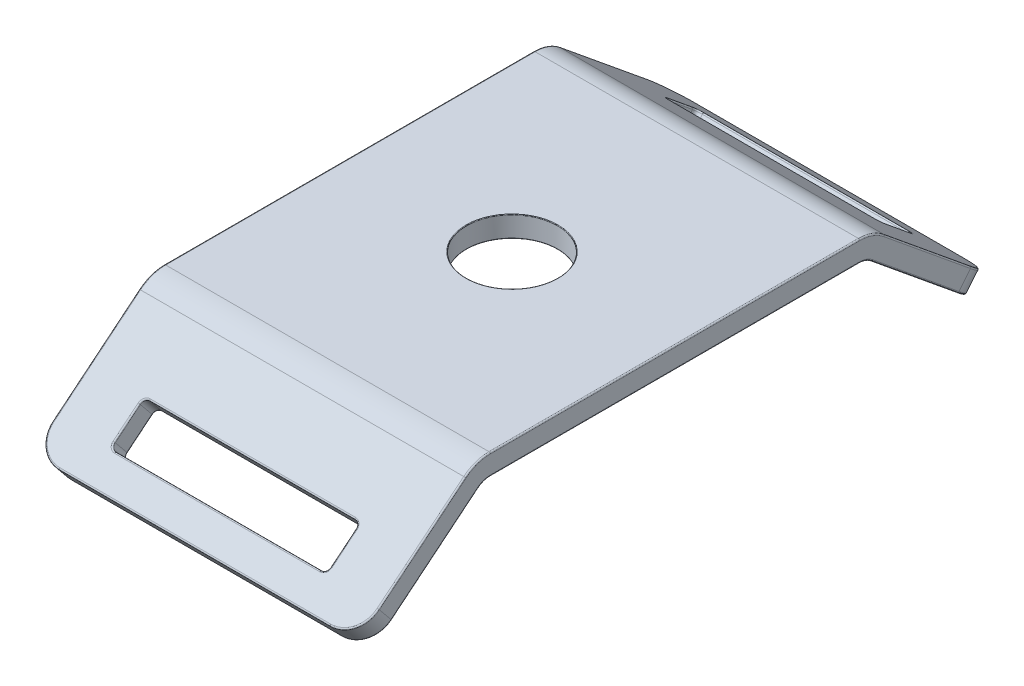
from build123d import *

# Parameters (mm, degrees)
BOSS_EXTRUDE1_DEPTH      = 7.5
BOSS_EXTRUDE1_DEPTH_BACK = 7.5
FILLET4_R                = 1.27
FILLET2_R                = 0.0635
CUT_EXTRUDE1_DEPTH       = 18.217723585
CUT_EXTRUDE1_DEPTH_BACK  = 18.217723585
SKETCH4_R                = 2.1
FILLET1_R                = 0.0254
CUT_EXTRUDE2_DEPTH       = 25.435726055
FILLET3_R                = 0.0635


with BuildPart() as part:
    # Sketch3 → Boss-Extrude1 (new, two sides: drawn at the far end of the back side and taken through both)
    with BuildSketch(Plane(origin=(0, 0, 0), x_dir=(0, 0, -1), z_dir=(1, 0, 0)).offset(-BOSS_EXTRUDE1_DEPTH_BACK)):
        with BuildLine():
            Line((-14.576716292, -1.838688841), (-9.658229197, 2.186478971))
            ThreePointArc((-9.658229197, 2.186478971), (-9.114917579, 2.493519892), (-8.5, 2.6))
            Line((-8.5, 2.6), (8.5, 2.6))
            ThreePointArc((8.5, 2.6), (9.114917579, 2.493519892), (9.658229197, 2.186478971))
            Line((9.658229197, 2.186478971), (14.576716292, -1.838688841))
            ThreePointArc((14.576716292, -1.838688841), (14.599685593, -1.881519304), (14.585641631, -1.928046763))
            Line((14.585641631, -1.928046763), (14.054786582, -2.576716292))
            ThreePointArc((14.054786582, -2.576716292), (14.011956119, -2.599685593), (13.96542866, -2.585641631))
            Line((13.96542866, -2.585641631), (9.060977542, 1.428039486))
            ThreePointArc((9.060977542, 1.428039486), (8.789321733, 1.581559946), (8.481862944, 1.6348))
            Line((8.481862944, 1.6348), (-8.481862944, 1.6348))
            ThreePointArc((-8.481862944, 1.6348), (-8.789321733, 1.581559946), (-9.060977542, 1.428039486))
            Line((-9.060977542, 1.428039486), (-13.96542866, -2.585641631))
            ThreePointArc((-13.96542866, -2.585641631), (-14.011956119, -2.599685593), (-14.054786582, -2.576716292))
            Line((-14.054786582, -2.576716292), (-14.585641631, -1.928046763))
            ThreePointArc((-14.585641631, -1.928046763), (-14.599685593, -1.881519304), (-14.576716292, -1.838688841))
        make_face()
    extrude(amount=BOSS_EXTRUDE1_DEPTH + BOSS_EXTRUDE1_DEPTH_BACK)

    # Fillet4
    # the kernel refuses this fillet: 1.27 mm, written as the material it takes off along each edge
    with BuildSketch(Plane(origin=(-7.5, -5.033797839, 12.043972003), x_dir=(1, 0, 0), z_dir=(0, 0.7738839518742416, 0.6333274264008363)), Plane(origin=(-7.5, 0.529034784, -16.59645621), x_dir=(1, 0, 0), z_dir=(0, -0.7738839518742416, 0.6333274264008363))) as fillet4_piece_1:
        with BuildLine():
            CenterArc((FILLET4_R, FILLET4_R), FILLET4_R, 180, 90)
            Line((0, FILLET4_R), (0, 0))
            Line((0, 0), (FILLET4_R, 0))
        make_face()
    extrude(amount=7.1882, mode=Mode.SUBTRACT)
    with BuildSketch(Plane(origin=(7.5, -5.033797839, 12.043972003), x_dir=(-1, 0, 0), z_dir=(0, 0.7738839518742416, 0.6333274264008363)), Plane(origin=(7.5, 0.529034784, -16.59645621), x_dir=(-1, 0, 0), z_dir=(0, -0.7738839518742416, 0.6333274264008363))) as fillet4_piece_2:
        with BuildLine():
            CenterArc((FILLET4_R, -FILLET4_R), FILLET4_R, 90, 90)
            Line((0, -FILLET4_R), (0, 0))
            Line((0, 0), (FILLET4_R, 0))
        make_face()
    extrude(amount=7.1882, mode=Mode.SUBTRACT)

    # Fillet2
    # the kernel refuses this fillet: 0.0635 mm, written as the material it takes off along each edge
    with BuildSketch(Plane(origin=(-7.5, 1.428039486, 9.060977542), x_dir=(1, 0, 0), z_dir=(0, -0.6333274264008348, 0.7738839518742426)), Plane(origin=(7.5, -1.821532091, -13.031737672), x_dir=(0, 0.7738839518742426, -0.6333274264008346), z_dir=(0, 0.6333274264008347, 0.7738839518742427))) as fillet2_piece_1:
        with BuildLine():
            CenterArc((FILLET2_R, FILLET2_R), FILLET2_R, 180, 90)
            Line((0, FILLET2_R), (-FILLET2_R * 0.02, FILLET2_R))
            Line((-FILLET2_R * 0.02, FILLET2_R), (-FILLET2_R * 0.02, -FILLET2_R * 0.02))
            Line((-FILLET2_R * 0.02, -FILLET2_R * 0.02), (FILLET2_R, -FILLET2_R * 0.02))
            Line((FILLET2_R, -FILLET2_R * 0.02), (FILLET2_R, 0))
        make_face()
    extrude(amount=5.130950344, mode=Mode.SUBTRACT)
    with BuildSketch(Plane(origin=(-7.5, 0.7204, 8.481862944), x_dir=(0, 1, 0), z_dir=(0, 0, -1))) as fillet2_piece_2:
        with BuildLine():
            CenterArc((0.9144 + FILLET2_R, FILLET2_R), FILLET2_R, 180, 90)
            Line((0.9144, FILLET2_R), (0.9144 - FILLET2_R * 0.02, FILLET2_R))
            Line((0.9144 - FILLET2_R * 0.02, FILLET2_R), (0.9144 - FILLET2_R * 0.02, -FILLET2_R * 0.02))
            Line((0.9144 - FILLET2_R * 0.02, -FILLET2_R * 0.02), (0.9144 + FILLET2_R, -FILLET2_R * 0.02))
            Line((0.9144 + FILLET2_R, -FILLET2_R * 0.02), (0.9144 + FILLET2_R, 0))
        make_face()
    revolve(axis=Axis((-7.5, 0.7204, 8.481862944), (1, 0, 0)), revolution_arc=39.296042908, mode=Mode.SUBTRACT)
    with BuildSketch(Plane(origin=(-7.5, 1.6348, -8.481862944), x_dir=(0, 1, 0), z_dir=(0, 0, 1))) as fillet2_piece_3:
        with BuildLine():
            CenterArc((FILLET2_R, -FILLET2_R), FILLET2_R, 90, 90)
            Line((0, -FILLET2_R), (-FILLET2_R * 0.02, -FILLET2_R))
            Line((-FILLET2_R * 0.02, -FILLET2_R), (-FILLET2_R * 0.02, FILLET2_R * 0.02))
            Line((-FILLET2_R * 0.02, FILLET2_R * 0.02), (FILLET2_R, FILLET2_R * 0.02))
            Line((FILLET2_R, FILLET2_R * 0.02), (FILLET2_R, 0))
        make_face()
    extrude(amount=16.963725887, mode=Mode.SUBTRACT)
    with BuildSketch(Plane(origin=(-7.5, 0.7204, -8.481862944), x_dir=(0, 0.7738839518742434, -0.6333274264008341), z_dir=(0, -0.6333274264008341, -0.7738839518742434))) as fillet2_piece_4:
        with BuildLine():
            CenterArc((0.9144 + FILLET2_R, FILLET2_R), FILLET2_R, 180, 90)
            Line((0.9144, FILLET2_R), (0.9144 - FILLET2_R * 0.02, FILLET2_R))
            Line((0.9144 - FILLET2_R * 0.02, FILLET2_R), (0.9144 - FILLET2_R * 0.02, -FILLET2_R * 0.02))
            Line((0.9144 - FILLET2_R * 0.02, -FILLET2_R * 0.02), (0.9144 + FILLET2_R, -FILLET2_R * 0.02))
            Line((0.9144 + FILLET2_R, -FILLET2_R * 0.02), (0.9144 + FILLET2_R, 0))
        make_face()
    revolve(axis=Axis((-7.5, 0.7204, -8.481862944), (1, 0, 0)), revolution_arc=39.296042908, mode=Mode.SUBTRACT)
    with BuildSketch(Plane(origin=(-7.5, -1.821532091, -13.031737672), x_dir=(0, 0.7738839518742426, -0.6333274264008346), z_dir=(0, 0.6333274264008347, 0.7738839518742427)), Plane(origin=(7.5, 1.428039486, 9.060977542), x_dir=(-1, 0, 0), z_dir=(0, -0.6333274264008348, 0.7738839518742426))) as fillet2_piece_5:
        with BuildLine():
            CenterArc((FILLET2_R, -FILLET2_R), FILLET2_R, 90, 90)
            Line((0, -FILLET2_R), (-FILLET2_R * 0.02, -FILLET2_R))
            Line((-FILLET2_R * 0.02, -FILLET2_R), (-FILLET2_R * 0.02, FILLET2_R * 0.02))
            Line((-FILLET2_R * 0.02, FILLET2_R * 0.02), (FILLET2_R, FILLET2_R * 0.02))
            Line((FILLET2_R, FILLET2_R * 0.02), (FILLET2_R, 0))
        make_face()
    extrude(amount=5.130950344, mode=Mode.SUBTRACT)
    with BuildSketch(Plane(origin=(-7.5, 2.186478971, -9.658229197), x_dir=(0, -0.7738839518742431, 0.6333274264008345), z_dir=(0, -0.6333274264008345, -0.7738839518742431)), Plane(origin=(7.5, -1.074579301, 13.643025304), x_dir=(-1, 0, 0), z_dir=(0, 0.6333274264008345, -0.773883951874243))) as fillet2_piece_6:
        with BuildLine():
            CenterArc((FILLET2_R, -FILLET2_R), FILLET2_R, 90, 90)
            Line((0, -FILLET2_R), (-FILLET2_R * 0.02, -FILLET2_R))
            Line((-FILLET2_R * 0.02, -FILLET2_R), (-FILLET2_R * 0.02, FILLET2_R * 0.02))
            Line((-FILLET2_R * 0.02, FILLET2_R * 0.02), (FILLET2_R, FILLET2_R * 0.02))
            Line((FILLET2_R, FILLET2_R * 0.02), (FILLET2_R, 0))
        make_face()
    extrude(amount=5.149087401, mode=Mode.SUBTRACT)
    with BuildSketch(Plane(origin=(-7.5, 0.7712, -8.5), x_dir=(0, 1, 0), z_dir=(0, 0, 1))) as fillet2_piece_7:
        with BuildLine():
            CenterArc((1.8288 - FILLET2_R, -FILLET2_R), FILLET2_R, 0, 90)
            Line((1.8288, -FILLET2_R), (1.8288 + FILLET2_R * 0.02, -FILLET2_R))
            Line((1.8288 + FILLET2_R * 0.02, -FILLET2_R), (1.8288 + FILLET2_R * 0.02, FILLET2_R * 0.02))
            Line((1.8288 + FILLET2_R * 0.02, FILLET2_R * 0.02), (1.8288 - FILLET2_R, FILLET2_R * 0.02))
            Line((1.8288 - FILLET2_R, FILLET2_R * 0.02), (1.8288 - FILLET2_R, 0))
        make_face()
    revolve(axis=Axis((-7.5, 0.7712, -8.5), (-1, 0, 0)), revolution_arc=39.296042908, mode=Mode.SUBTRACT)
    with BuildSketch(Plane(origin=(-7.5, 2.6, 8.5), x_dir=(0, -1, 0), z_dir=(0, 0, -1))) as fillet2_piece_8:
        with BuildLine():
            CenterArc((FILLET2_R, -FILLET2_R), FILLET2_R, 90, 90)
            Line((0, -FILLET2_R), (-FILLET2_R * 0.02, -FILLET2_R))
            Line((-FILLET2_R * 0.02, -FILLET2_R), (-FILLET2_R * 0.02, FILLET2_R * 0.02))
            Line((-FILLET2_R * 0.02, FILLET2_R * 0.02), (FILLET2_R, FILLET2_R * 0.02))
            Line((FILLET2_R, FILLET2_R * 0.02), (FILLET2_R, 0))
        make_face()
    extrude(amount=17, mode=Mode.SUBTRACT)
    with BuildSketch(Plane(origin=(-7.5, 0.7712, 8.5), x_dir=(0, 0.7738839518742435, 0.6333274264008336), z_dir=(0, -0.6333274264008336, 0.7738839518742435))) as fillet2_piece_9:
        with BuildLine():
            CenterArc((1.8288 - FILLET2_R, -FILLET2_R), FILLET2_R, 0, 90)
            Line((1.8288, -FILLET2_R), (1.8288 + FILLET2_R * 0.02, -FILLET2_R))
            Line((1.8288 + FILLET2_R * 0.02, -FILLET2_R), (1.8288 + FILLET2_R * 0.02, FILLET2_R * 0.02))
            Line((1.8288 + FILLET2_R * 0.02, FILLET2_R * 0.02), (1.8288 - FILLET2_R, FILLET2_R * 0.02))
            Line((1.8288 - FILLET2_R, FILLET2_R * 0.02), (1.8288 - FILLET2_R, 0))
        make_face()
    revolve(axis=Axis((-7.5, 0.7712, 8.5), (-1, 0, 0)), revolution_arc=39.296042908, mode=Mode.SUBTRACT)
    with BuildSketch(Plane(origin=(-7.5, -1.074579301, 13.643025304), x_dir=(1, 0, 0), z_dir=(0, 0.6333274264008345, -0.773883951874243)), Plane(origin=(7.5, 2.186478971, -9.658229197), x_dir=(0, -0.7738839518742431, 0.6333274264008345), z_dir=(0, -0.6333274264008345, -0.7738839518742431))) as fillet2_piece_10:
        with BuildLine():
            CenterArc((FILLET2_R, FILLET2_R), FILLET2_R, 180, 90)
            Line((0, FILLET2_R), (-FILLET2_R * 0.02, FILLET2_R))
            Line((-FILLET2_R * 0.02, FILLET2_R), (-FILLET2_R * 0.02, -FILLET2_R * 0.02))
            Line((-FILLET2_R * 0.02, -FILLET2_R * 0.02), (FILLET2_R, -FILLET2_R * 0.02))
            Line((FILLET2_R, -FILLET2_R * 0.02), (FILLET2_R, 0))
        make_face()
    extrude(amount=5.149087401, mode=Mode.SUBTRACT)
    with BuildSketch(Plane(origin=(7.5, 0.7712, 8.5), x_dir=(0, 0.7738839518742435, 0.6333274264008336), z_dir=(0, -0.6333274264008336, 0.7738839518742435))) as fillet2_piece_11:
        with BuildLine():
            CenterArc((1.8288 - FILLET2_R, FILLET2_R), FILLET2_R, 270, 90)
            Line((1.8288, FILLET2_R), (1.8288 + FILLET2_R * 0.02, FILLET2_R))
            Line((1.8288 + FILLET2_R * 0.02, FILLET2_R), (1.8288 + FILLET2_R * 0.02, -FILLET2_R * 0.02))
            Line((1.8288 + FILLET2_R * 0.02, -FILLET2_R * 0.02), (1.8288 - FILLET2_R, -FILLET2_R * 0.02))
            Line((1.8288 - FILLET2_R, -FILLET2_R * 0.02), (1.8288 - FILLET2_R, 0))
        make_face()
    revolve(axis=Axis((7.5, 0.7712, 8.5), (-1, 0, 0)), revolution_arc=39.296042908, mode=Mode.SUBTRACT)
    with BuildSketch(Plane(origin=(7.5, 2.6, 8.5), x_dir=(0, -1, 0), z_dir=(0, 0, -1))) as fillet2_piece_12:
        with BuildLine():
            CenterArc((FILLET2_R, FILLET2_R), FILLET2_R, 180, 90)
            Line((0, FILLET2_R), (-FILLET2_R * 0.02, FILLET2_R))
            Line((-FILLET2_R * 0.02, FILLET2_R), (-FILLET2_R * 0.02, -FILLET2_R * 0.02))
            Line((-FILLET2_R * 0.02, -FILLET2_R * 0.02), (FILLET2_R, -FILLET2_R * 0.02))
            Line((FILLET2_R, -FILLET2_R * 0.02), (FILLET2_R, 0))
        make_face()
    extrude(amount=17, mode=Mode.SUBTRACT)
    with BuildSketch(Plane(origin=(7.5, 0.7712, -8.5), x_dir=(0, 1, 0), z_dir=(0, 0, 1))) as fillet2_piece_13:
        with BuildLine():
            CenterArc((1.8288 - FILLET2_R, FILLET2_R), FILLET2_R, 270, 90)
            Line((1.8288, FILLET2_R), (1.8288 + FILLET2_R * 0.02, FILLET2_R))
            Line((1.8288 + FILLET2_R * 0.02, FILLET2_R), (1.8288 + FILLET2_R * 0.02, -FILLET2_R * 0.02))
            Line((1.8288 + FILLET2_R * 0.02, -FILLET2_R * 0.02), (1.8288 - FILLET2_R, -FILLET2_R * 0.02))
            Line((1.8288 - FILLET2_R, -FILLET2_R * 0.02), (1.8288 - FILLET2_R, 0))
        make_face()
    revolve(axis=Axis((7.5, 0.7712, -8.5), (-1, 0, 0)), revolution_arc=39.296042908, mode=Mode.SUBTRACT)
    with BuildSketch(Plane(origin=(7.5, 0.7204, -8.481862944), x_dir=(0, 0.7738839518742434, -0.6333274264008341), z_dir=(0, -0.6333274264008341, -0.7738839518742434))) as fillet2_piece_14:
        with BuildLine():
            CenterArc((0.9144 + FILLET2_R, -FILLET2_R), FILLET2_R, 90, 90)
            Line((0.9144, -FILLET2_R), (0.9144 - FILLET2_R * 0.02, -FILLET2_R))
            Line((0.9144 - FILLET2_R * 0.02, -FILLET2_R), (0.9144 - FILLET2_R * 0.02, FILLET2_R * 0.02))
            Line((0.9144 - FILLET2_R * 0.02, FILLET2_R * 0.02), (0.9144 + FILLET2_R, FILLET2_R * 0.02))
            Line((0.9144 + FILLET2_R, FILLET2_R * 0.02), (0.9144 + FILLET2_R, 0))
        make_face()
    revolve(axis=Axis((7.5, 0.7204, -8.481862944), (1, 0, 0)), revolution_arc=39.296042908, mode=Mode.SUBTRACT)
    with BuildSketch(Plane(origin=(7.5, 1.6348, -8.481862944), x_dir=(0, 1, 0), z_dir=(0, 0, 1))) as fillet2_piece_15:
        with BuildLine():
            CenterArc((FILLET2_R, FILLET2_R), FILLET2_R, 180, 90)
            Line((0, FILLET2_R), (-FILLET2_R * 0.02, FILLET2_R))
            Line((-FILLET2_R * 0.02, FILLET2_R), (-FILLET2_R * 0.02, -FILLET2_R * 0.02))
            Line((-FILLET2_R * 0.02, -FILLET2_R * 0.02), (FILLET2_R, -FILLET2_R * 0.02))
            Line((FILLET2_R, -FILLET2_R * 0.02), (FILLET2_R, 0))
        make_face()
    extrude(amount=16.963725887, mode=Mode.SUBTRACT)
    with BuildSketch(Plane(origin=(7.5, 0.7204, 8.481862944), x_dir=(0, 1, 0), z_dir=(0, 0, -1))) as fillet2_piece_16:
        with BuildLine():
            CenterArc((0.9144 + FILLET2_R, -FILLET2_R), FILLET2_R, 90, 90)
            Line((0.9144, -FILLET2_R), (0.9144 - FILLET2_R * 0.02, -FILLET2_R))
            Line((0.9144 - FILLET2_R * 0.02, -FILLET2_R), (0.9144 - FILLET2_R * 0.02, FILLET2_R * 0.02))
            Line((0.9144 - FILLET2_R * 0.02, FILLET2_R * 0.02), (0.9144 + FILLET2_R, FILLET2_R * 0.02))
            Line((0.9144 + FILLET2_R, FILLET2_R * 0.02), (0.9144 + FILLET2_R, 0))
        make_face()
    revolve(axis=Axis((7.5, 0.7204, 8.481862944), (1, 0, 0)), revolution_arc=39.296042908, mode=Mode.SUBTRACT)
    with BuildSketch(Plane(origin=(-6.23, -1.074579301, -13.643025304), x_dir=(-0.017482835375582595, -0.6332306308881265, -0.7737656742013408), z_dir=(0.9998471635541255, -0.011072359134611005, -0.013529685730419553))) as fillet2_piece_17:
        with BuildLine():
            CenterArc((1.27 - FILLET2_R, -FILLET2_R), FILLET2_R, 0, 90)
            Line((1.27 - FILLET2_R, 0), (1.27 - FILLET2_R, FILLET2_R * 0.0199999999997))
            Line((1.27 - FILLET2_R, FILLET2_R * 0.0199999999997), (1.27 + FILLET2_R * 0.02, FILLET2_R * 0.02))
            Line((1.27 + FILLET2_R * 0.02, FILLET2_R * 0.02), (1.27 + FILLET2_R * 0.02, -FILLET2_R))
            Line((1.27 + FILLET2_R * 0.02, -FILLET2_R), (1.27, -FILLET2_R))
        make_face()
    revolve(axis=Axis((-6.23, -1.074579301, -13.643025304), (0, 0.7738839518740644, -0.6333274264010527)), revolution_arc=88.998256284, mode=Mode.SUBTRACT)
    with BuildSketch(Plane(origin=(-6.23, -1.074579301, 13.643025304), x_dir=(-0.01748283537898076, -0.633230630888089, 0.7737656742012949), z_dir=(0.9998471635540662, -0.011072359136763157, 0.013529685733049336))) as fillet2_piece_18:
        with BuildLine():
            CenterArc((1.27 - FILLET2_R, FILLET2_R), FILLET2_R, 270, 90)
            Line((1.27 - FILLET2_R, 0), (1.27 - FILLET2_R, -FILLET2_R * 0.0199999999997))
            Line((1.27 - FILLET2_R, -FILLET2_R * 0.0199999999997), (1.27 + FILLET2_R * 0.02, -FILLET2_R * 0.02))
            Line((1.27 + FILLET2_R * 0.02, -FILLET2_R * 0.02), (1.27 + FILLET2_R * 0.02, FILLET2_R))
            Line((1.27 + FILLET2_R * 0.02, FILLET2_R), (1.27, FILLET2_R))
        make_face()
    revolve(axis=Axis((-6.23, -1.074579301, 13.643025304), (0, -0.7738839518740644, -0.6333274264010527)), revolution_arc=88.998256284, mode=Mode.SUBTRACT)
    with BuildSketch(Plane(origin=(-6.23, -1.821532091, 13.031737672), x_dir=(-0.017482835378398207, -0.6332306308880957, 0.7737656742013023), z_dir=(0.9998471635540762, -0.01107235913639421, 0.01352968573259851))) as fillet2_piece_19:
        with BuildLine():
            CenterArc((1.27 - FILLET2_R, -FILLET2_R), FILLET2_R, 0, 90)
            Line((1.27 - FILLET2_R, 0), (1.27 - FILLET2_R, FILLET2_R * 0.0200000000003))
            Line((1.27 - FILLET2_R, FILLET2_R * 0.0200000000003), (1.27 + FILLET2_R * 0.02, FILLET2_R * 0.02))
            Line((1.27 + FILLET2_R * 0.02, FILLET2_R * 0.02), (1.27 + FILLET2_R * 0.02, -FILLET2_R))
            Line((1.27 + FILLET2_R * 0.02, -FILLET2_R), (1.27, -FILLET2_R))
        make_face()
    revolve(axis=Axis((-6.23, -1.821532091, 13.031737672), (0, -0.7738839518740644, -0.6333274264010527)), revolution_arc=88.998256284, mode=Mode.SUBTRACT)
    with BuildSketch(Plane(origin=(-6.23, -1.821532091, -13.031737672), x_dir=(-0.01748283537503431, -0.6332306308881327, -0.7737656742013482), z_dir=(0.9998471635541353, -0.011072359134263762, -0.013529685729995244))) as fillet2_piece_20:
        with BuildLine():
            CenterArc((1.27 - FILLET2_R, FILLET2_R), FILLET2_R, 270, 90)
            Line((1.27, FILLET2_R), (1.27 + FILLET2_R * 0.02, FILLET2_R))
            Line((1.27 + FILLET2_R * 0.02, FILLET2_R), (1.27 + FILLET2_R * 0.02, -FILLET2_R * 0.02))
            Line((1.27 + FILLET2_R * 0.02, -FILLET2_R * 0.02), (1.27 - FILLET2_R, -FILLET2_R * 0.0200000000003))
            Line((1.27 - FILLET2_R, -FILLET2_R * 0.0200000000003), (1.27 - FILLET2_R, 0))
        make_face()
    revolve(axis=Axis((-6.23, -1.821532091, -13.031737672), (0, 0.7738839518740644, -0.6333274264010527)), revolution_arc=88.998256284, mode=Mode.SUBTRACT)
    with BuildSketch(Plane(origin=(6.23, -1.821532091, 13.031737672), x_dir=(1, 0, 0), z_dir=(0, 0.6333274264010527, -0.7738839518740644))) as fillet2_piece_21:
        with BuildLine():
            CenterArc((1.27 - FILLET2_R, -FILLET2_R), FILLET2_R, 360, 90)
            Line((1.27 - FILLET2_R, 0), (1.27 - FILLET2_R, FILLET2_R * 0.02))
            Line((1.27 - FILLET2_R, FILLET2_R * 0.02), (1.27 + FILLET2_R * 0.02, FILLET2_R * 0.02))
            Line((1.27 + FILLET2_R * 0.02, FILLET2_R * 0.02), (1.27 + FILLET2_R * 0.02, -FILLET2_R))
            Line((1.27 + FILLET2_R * 0.02, -FILLET2_R), (1.27, -FILLET2_R))
        make_face()
    revolve(axis=Axis((6.23, -1.821532091, 13.031737672), (0, -0.7738839518740644, -0.6333274264010527)), revolution_arc=88.998256284, mode=Mode.SUBTRACT)
    with BuildSketch(Plane(origin=(6.23, -1.821532091, -13.031737672), x_dir=(1, 0, 0), z_dir=(0, 0.6333274264010527, 0.7738839518740644))) as fillet2_piece_22:
        with BuildLine():
            CenterArc((1.27 - FILLET2_R, FILLET2_R), FILLET2_R, 270, 90)
            Line((1.27, FILLET2_R), (1.27 + FILLET2_R * 0.02, FILLET2_R))
            Line((1.27 + FILLET2_R * 0.02, FILLET2_R), (1.27 + FILLET2_R * 0.02, -FILLET2_R * 0.02))
            Line((1.27 + FILLET2_R * 0.02, -FILLET2_R * 0.02), (1.27 - FILLET2_R, -FILLET2_R * 0.02))
            Line((1.27 - FILLET2_R, -FILLET2_R * 0.02), (1.27 - FILLET2_R, 0))
        make_face()
    revolve(axis=Axis((6.23, -1.821532091, -13.031737672), (0, 0.7738839518740644, -0.6333274264010527)), revolution_arc=88.998256284, mode=Mode.SUBTRACT)
    with BuildSketch(Plane(origin=(6.23, -1.074579301, -13.643025304), x_dir=(1, 0, 0), z_dir=(0, 0.6333274264010527, 0.7738839518740644))) as fillet2_piece_23:
        with BuildLine():
            CenterArc((1.27 - FILLET2_R, -FILLET2_R), FILLET2_R, 0, 90)
            Line((1.27, -FILLET2_R), (1.27 + FILLET2_R * 0.02, -FILLET2_R))
            Line((1.27 + FILLET2_R * 0.02, -FILLET2_R), (1.27 + FILLET2_R * 0.02, FILLET2_R * 0.02))
            Line((1.27 + FILLET2_R * 0.02, FILLET2_R * 0.02), (1.27 - FILLET2_R, FILLET2_R * 0.02))
            Line((1.27 - FILLET2_R, FILLET2_R * 0.02), (1.27 - FILLET2_R, 0))
        make_face()
    revolve(axis=Axis((6.23, -1.074579301, -13.643025304), (0, 0.7738839518740644, -0.6333274264010527)), revolution_arc=88.998256284, mode=Mode.SUBTRACT)
    with BuildSketch(Plane(origin=(6.23, -1.074579301, 13.643025304), x_dir=(1, 0, 0), z_dir=(0, 0.6333274264010527, -0.7738839518740644))) as fillet2_piece_24:
        with BuildLine():
            CenterArc((1.27 - FILLET2_R, FILLET2_R), FILLET2_R, 270, 90)
            Line((1.27 - FILLET2_R, 0), (1.27 - FILLET2_R, -FILLET2_R * 0.02))
            Line((1.27 - FILLET2_R, -FILLET2_R * 0.02), (1.27 + FILLET2_R * 0.02, -FILLET2_R * 0.02))
            Line((1.27 + FILLET2_R * 0.02, -FILLET2_R * 0.02), (1.27 + FILLET2_R * 0.02, FILLET2_R))
            Line((1.27 + FILLET2_R * 0.02, FILLET2_R), (1.27, FILLET2_R))
        make_face()
    revolve(axis=Axis((6.23, -1.074579301, 13.643025304), (0, -0.7738839518740644, -0.6333274264010527)), revolution_arc=88.998256284, mode=Mode.SUBTRACT)

    # Sketch4 → Cut-Extrude1 (cut, two sides: drawn at the far end of the back side and taken through both)
    with BuildSketch(Plane(origin=(0, 2.6, 0), x_dir=(1, 0, 0), z_dir=(0, 1, 0)).offset(-CUT_EXTRUDE1_DEPTH_BACK)):
        with Locations(Location((0, 0, 0), (0, 0, 270))):
            Circle(SKETCH4_R)
    extrude(amount=CUT_EXTRUDE1_DEPTH + CUT_EXTRUDE1_DEPTH_BACK, mode=Mode.SUBTRACT)

    # Fillet1
    fillet1_edges = [part.edges().sort_by_distance(p)[0] for p in [
        (0, 2.6, -2.1),
        (0, 1.6348, -2.1),
    ]]
    fillet(fillet1_edges, radius=FILLET1_R)

    # Sketch6 → Cut-Extrude2 (cut, symmetric)
    with BuildSketch(Plane(origin=(0, 3.723510983, -7.780078406), x_dir=(1, 0, 0), z_dir=(0, -0.7738839518742429, 0.6333274264008345))):
        with BuildLine():
            Line((4.721, -7.416002686), (-4.721, -7.416002686))
            ThreePointArc((-4.721, -7.416002686), (-4.900605122, -7.341607808), (-4.975, -7.162002686))
            Line((-4.975, -7.162002686), (-4.975, -5.670002686))
            ThreePointArc((-4.975, -5.670002686), (-4.900605122, -5.490397564), (-4.721, -5.416002686))
            Line((-4.721, -5.416002686), (4.721, -5.416002686))
            ThreePointArc((4.721, -5.416002686), (4.900605122, -5.490397564), (4.975, -5.670002686))
            Line((4.975, -5.670002686), (4.975, -7.162002686))
            ThreePointArc((4.975, -7.162002686), (4.900605122, -7.341607808), (4.721, -7.416002686))
        make_face()
    cut_extrude2 = extrude(amount=CUT_EXTRUDE2_DEPTH, both=True, mode=Mode.SUBTRACT)

    # Mirror1: Cut-Extrude2 across plane
    add(cut_extrude2.mirror(Plane.XY), mode=Mode.SUBTRACT)

    # Fillet3
    fillet3_edges = [part.edges().sort_by_distance(p)[0] for p in [
        (0, -0.973246912, -13.519203871),
        (4.900605122, -0.926130596, -13.461630869),
        (4.975, -0.339919486, -12.745319919),
        (4.900605122, 0.246291624, -12.029008969),
        (0, 0.29340794, -11.971435968),
        (-4.900605122, 0.246291624, -12.029008969),
        (-4.975, -0.339919486, -12.745319919),
        (-4.900605122, -0.926130596, -13.461630869),
        (-4.900605122, -1.673083386, -12.850343238),
        (-4.975, -1.086872276, -12.134032288),
        (-4.900605122, -0.500661166, -11.417721337),
        (0, -0.45354485, -11.360148336),
        (4.900605122, -0.500661166, -11.417721337),
        (4.975, -1.086872276, -12.134032288),
        (4.900605122, -1.673083386, -12.850343238),
        (0, -1.720199703, -12.907916239),
        (-4.975, -0.339919486, 12.745319919),
        (-4.900605122, 0.246291624, 12.029008969),
        (0, 0.29340794, 11.971435968),
        (4.900605122, 0.246291624, 12.029008969),
        (4.975, -0.339919486, 12.745319919),
        (4.900605122, -0.926130596, 13.461630869),
        (0, -0.973246912, 13.519203871),
        (-4.900605122, -0.926130596, 13.461630869),
        (-4.900605122, -1.673083386, 12.850343238),
        (0, -1.720199703, 12.907916239),
        (4.900605122, -1.673083386, 12.850343238),
        (4.975, -1.086872276, 12.134032288),
        (4.900605122, -0.500661166, 11.417721337),
        (0, -0.45354485, 11.360148336),
        (-4.900605122, -0.500661166, 11.417721337),
        (-4.975, -1.086872276, 12.134032288),
    ]]
    fillet(fillet3_edges, radius=FILLET3_R)


solid = part.part
